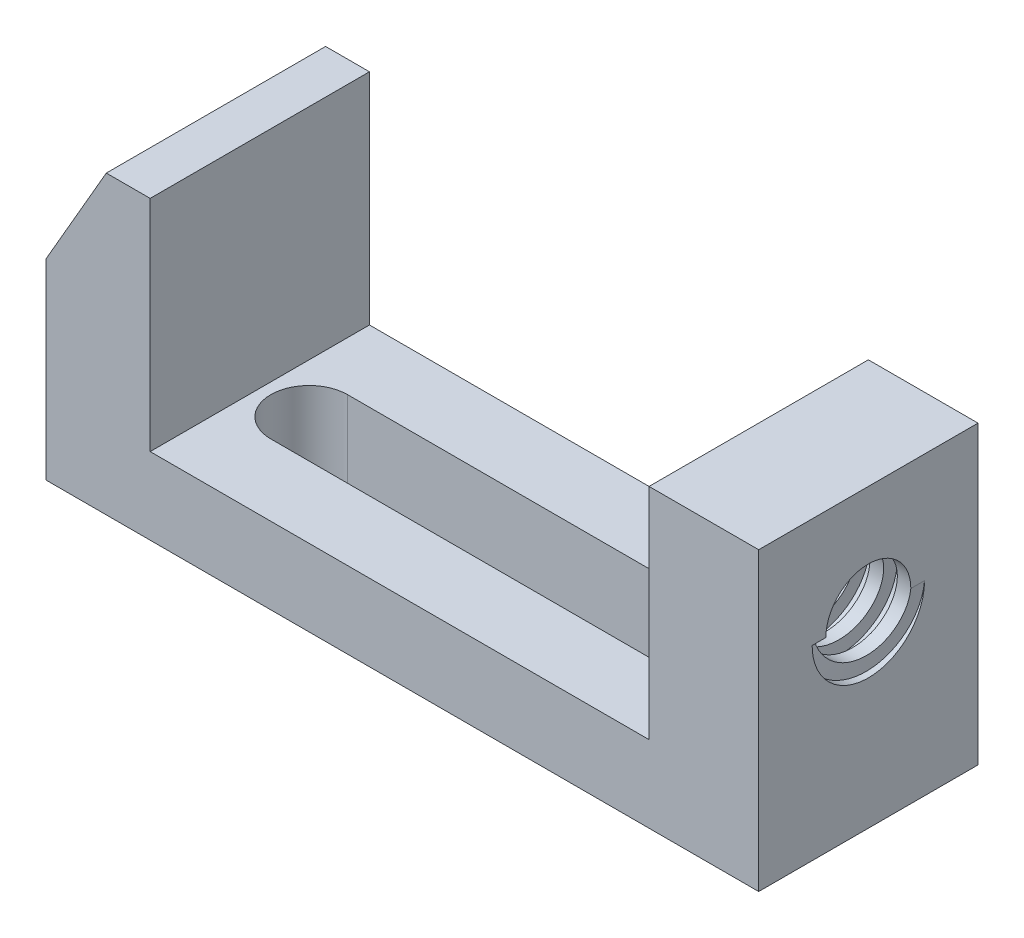
from build123d import *

# Parameters (mm, degrees)
RESSALTO_EXTRUS_O1_DEPTH  = 40
ESBO_O2_R                 = 7.75
CORTE_EXTRUS_O1_DEPTH     = 40
VARREDURA_DE_CORTE5_PITCH = 5
ESBO_O14_R                = 1.5875
CORTE_EXTRUS_O2_DEPTH     = 10
CORTE_EXTRUS_O3_DEPTH     = 20


with BuildPart() as part:
    # Esboço1 → Ressalto-extrusão1 (new body)
    with BuildSketch(Plane.XY):
        Polygon((0, 0), (130, 0), (130, 54), (110, 54), (110, 14), (19, 14), (19, 54), (11, 54), (0, 34.947441117), align=None)
    extrude(amount=-RESSALTO_EXTRUS_O1_DEPTH)

    # Esboço2 → Corte-extrusão1 (cut)
    with BuildSketch(Plane(origin=(130, 0, 0), x_dir=(0, 0, -1), z_dir=(1, 0, 0))):
        with Locations((20, 34)):
            Circle(ESBO_O2_R)
    extrude(amount=-CORTE_EXTRUS_O1_DEPTH, mode=Mode.SUBTRACT)

    # Varredura de corte5: arcs per turn and ends read off the stored shape
    # Varredura de corte5: the profile of Esboço12 profile screwed along a right-hand helix through 6.5 turns, 12 arcs to a turn; built about Z, then put on its axis
    varredura_de_corte5_z = Axis((0, 0, 0), (0, 0, 1))
    varredura_de_corte5_corners = [(7.7497, 0, -5), (7.7497, 0, -2.5), (10.25, 0, -2.5), (10.25, 0, -5)]
    with BuildLine(mode=Mode.PRIVATE) as varredura_de_corte5_profile:
        Line(varredura_de_corte5_corners[0], varredura_de_corte5_corners[1])
        Line(varredura_de_corte5_corners[1], varredura_de_corte5_corners[2])
        Line(varredura_de_corte5_corners[2], varredura_de_corte5_corners[3])
        Line(varredura_de_corte5_corners[3], varredura_de_corte5_corners[0])
    varredura_de_corte5_cap = Face(varredura_de_corte5_profile.wire())
    varredura_de_corte5_turn_angles = [0, 15, 30, 45, 60, 75, 90, 105, 120, 135, 150, 165, 180, 195, 210, 225, 240, 255, 270, 285, 300, 315, 330, 345, 360]
    varredura_de_corte5_turn_weights = [1, 0.9659258262890683, 1, 0.9659258262890683, 1, 0.9659258262890683, 1, 0.9659258262890683, 1, 0.9659258262890683, 1, 0.9659258262890683, 1, 0.9659258262890683, 1, 0.9659258262890683, 1, 0.9659258262890683, 1, 0.9659258262890683, 1, 0.9659258262890683, 1, 0.9659258262890683, 1]
    varredura_de_corte5_turn_rails = [Edge.make_bspline([Vector(p[0], p[1], 0).rotate(varredura_de_corte5_z, varredura_de_corte5_turn_angles[k]) / varredura_de_corte5_turn_weights[k] + Vector(0, 0, p[2] + VARREDURA_DE_CORTE5_PITCH * varredura_de_corte5_turn_angles[k] / 360) for k in range(25)], [0, 0, 0, 1, 1, 2, 2, 3, 3, 4, 4, 5, 5, 6, 6, 7, 7, 8, 8, 9, 9, 10, 10, 11, 11, 12, 12, 12], 2, varredura_de_corte5_turn_weights) for p in varredura_de_corte5_corners]
    varredura_de_corte5_turn_sides = [Face.make_surface_from_curves(varredura_de_corte5_turn_rails[p[0]], varredura_de_corte5_turn_rails[p[1]]) for p in [(0, 1), (1, 2), (2, 3), (3, 0)]]
    varredura_de_corte5_last_angles = [2160, 2175, 2190, 2205, 2220, 2235, 2250, 2265, 2280, 2295, 2310, 2325, 2340]
    varredura_de_corte5_last_weights = [1, 0.9659258262890683, 1, 0.9659258262890683, 1, 0.9659258262890683, 1, 0.9659258262890683, 1, 0.9659258262890683, 1, 0.9659258262890683, 1]
    varredura_de_corte5_last_rails = [Edge.make_bspline([Vector(p[0], p[1], 0).rotate(varredura_de_corte5_z, varredura_de_corte5_last_angles[k]) / varredura_de_corte5_last_weights[k] + Vector(0, 0, p[2] + VARREDURA_DE_CORTE5_PITCH * varredura_de_corte5_last_angles[k] / 360) for k in range(13)], [0, 0, 0, 1, 1, 2, 2, 3, 3, 4, 4, 5, 5, 6, 6, 6], 2, varredura_de_corte5_last_weights) for p in varredura_de_corte5_corners]
    varredura_de_corte5_last_sides = [Face.make_surface_from_curves(varredura_de_corte5_last_rails[p[0]], varredura_de_corte5_last_rails[p[1]]) for p in [(0, 1), (1, 2), (2, 3), (3, 0)]]
    varredura_de_corte5 = Plane(origin=(130, 34, -20), x_dir=(0, 0, 1), z_dir=(-1, 0, 0)) * Solid(Shell([*[p.moved(Location((0, 0, VARREDURA_DE_CORTE5_PITCH * i))) for i in range(6) for p in varredura_de_corte5_turn_sides], *varredura_de_corte5_last_sides, varredura_de_corte5_cap, varredura_de_corte5_cap.rotate(varredura_de_corte5_z, 2340).moved(Location((0, 0, VARREDURA_DE_CORTE5_PITCH * 2340 / 360)))]))
    add(varredura_de_corte5, mode=Mode.SUBTRACT)

    # Esboço14 → Corte-extrusão2 (cut)
    with BuildSketch(Plane.XZ):
        with Locations(Location((9.5, -35, 0), (0, 0, 270))):
            Circle(ESBO_O14_R)
        with Locations(Location((46.5, -35, 0), (0, 0, 270))):
            Circle(ESBO_O14_R)
        with Locations(Location((83.5, -35, 0), (0, 0, 270))):
            Circle(ESBO_O14_R)
        with Locations(Location((120.5, -35, 0), (0, 0, 270))):
            Circle(ESBO_O14_R)
        with Locations(Location((46.5, -5, 0), (0, 0, 270))):
            Circle(ESBO_O14_R)
        with Locations(Location((83.5, -5, 0), (0, 0, 270))):
            Circle(ESBO_O14_R)
        with Locations(Location((120.5, -5, 0), (0, 0, 270))):
            Circle(ESBO_O14_R)
        with Locations(Location((9.5, -5, 0), (0, 0, 270))):
            Circle(ESBO_O14_R)
    extrude(amount=-CORTE_EXTRUS_O2_DEPTH, mode=Mode.SUBTRACT)

    # Esboço15 → Corte-extrusão3 (cut)
    with BuildSketch(Plane(origin=(0, 14, 0), x_dir=(1, 0, 0), z_dir=(0, 1, 0))):
        with BuildLine():
            Line((28, 27), (101, 27))
            ThreePointArc((101, 27), (108, 20), (101, 13))
            Line((101, 13), (28, 13))
            ThreePointArc((28, 13), (21, 20), (28, 27))
        make_face()
    extrude(amount=-CORTE_EXTRUS_O3_DEPTH, mode=Mode.SUBTRACT)


solid = part.part
